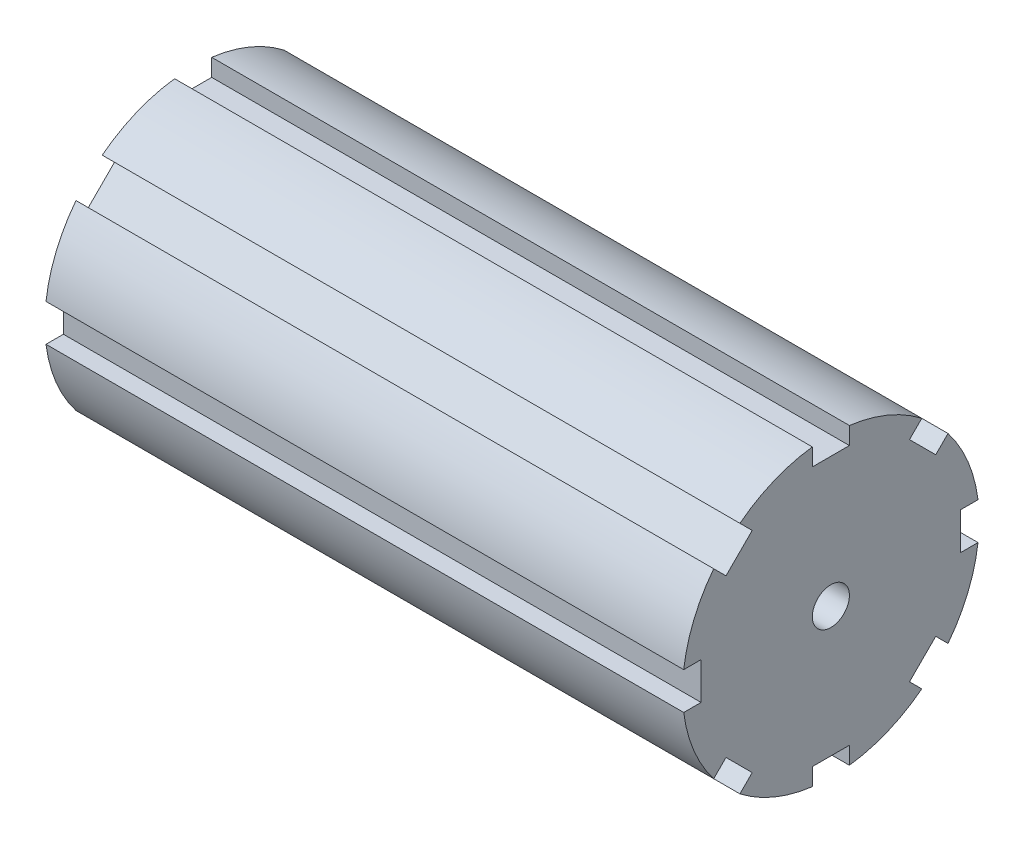
from build123d import *

# Parameters (mm, degrees)
SKETCH1_R           = 25.4
BOSS_EXTRUDE1_DEPTH = 109.22
SKETCH2_R           = 3.175
SKETCH2_W           = 6.35
SKETCH2_H           = 6.35
CUT_EXTRUDE1_DEPTH  = 109.22


with BuildPart() as part:
    # Sketch1 → Boss-Extrude1 (new body)
    with BuildSketch(Plane(origin=(0, 0, 0), x_dir=(0, 0, -1), z_dir=(1, 0, 0))):
        Circle(SKETCH1_R)
    extrude(amount=-BOSS_EXTRUDE1_DEPTH)

    # Sketch2 → Cut-Extrude1 (cut)
    with BuildSketch(Plane(origin=(0, 0, 0), x_dir=(0, 0, -1), z_dir=(1, 0, 0))):
        Circle(SKETCH2_R)
        Polygon((22.450640303, 17.960512242), (17.960512242, 22.450640303), (13.470384182, 17.960512242), (17.960512242, 13.470384182), align=None)
        with Locations((0, 25.4)):
            Rectangle(SKETCH2_W, SKETCH2_H)
        with Locations((25.4, 0)):
            Rectangle(SKETCH2_W, SKETCH2_H)
        Polygon((17.960512242, -22.450640303), (22.450640303, -17.960512242), (17.960512242, -13.470384182), (13.470384182, -17.960512242), align=None)
        with Locations((0, -25.4)):
            Rectangle(SKETCH2_W, SKETCH2_H)
        Polygon((-22.450640303, -17.960512242), (-17.960512242, -22.450640303), (-13.470384182, -17.960512242), (-17.960512242, -13.470384182), align=None)
        with Locations((-25.4, 0)):
            Rectangle(SKETCH2_W, SKETCH2_H)
        Polygon((-17.960512242, 22.450640303), (-22.450640303, 17.960512242), (-17.960512242, 13.470384182), (-13.470384182, 17.960512242), align=None)
    extrude(amount=-CUT_EXTRUDE1_DEPTH, mode=Mode.SUBTRACT)


solid = part.part
